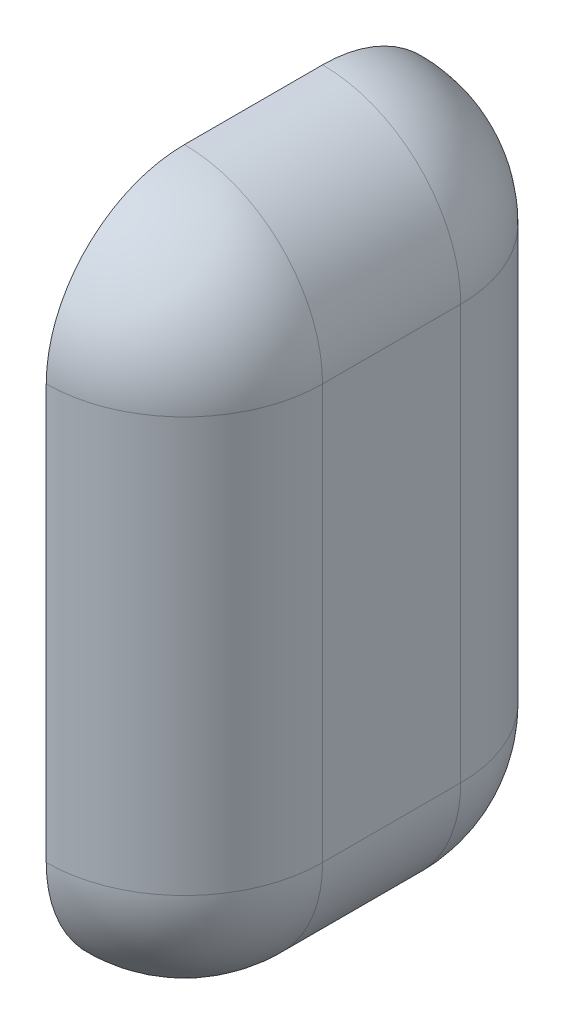
from build123d import *

# Parameters (mm, degrees)
BOSS_EXTRUDE1_DEPTH = 0.635
SKETCH2_W           = 3.81
SKETCH2_H           = 6.35
BOSS_EXTRUDE2_DEPTH = 1.27
FILLET4_R           = 1.27
FILLET5_R           = 1.27


with BuildPart() as part:
    # Sketch1 → Boss-Extrude1 (new body)
    with BuildSketch(Plane(origin=(0, 0, 0), x_dir=(0, 0, -1), z_dir=(1, 0, 0))):
        Polygon((-0.4445, 0.9525), (0.4445, 0.9525), (0.4445, -0.9525), (0.254, -1.2065), (-0.254, -1.2065), (-0.4445, -0.9525), align=None)
    extrude(amount=BOSS_EXTRUDE1_DEPTH)

    # Sketch2 → Boss-Extrude2 (add)
    with BuildSketch(Plane(origin=(0.635, 0, 0), x_dir=(0, 0, -1), z_dir=(1, 0, 0))):
        Rectangle(SKETCH2_W, SKETCH2_H)
    extrude(amount=BOSS_EXTRUDE2_DEPTH)

    # Fillet4
    fillet4_edges = [part.edges().sort_by_distance(p)[0] for p in [
        (1.905, -3.175, 0),
        (1.905, 3.175, 0),
    ]]
    fillet(fillet4_edges, radius=FILLET4_R - 0.0001)  # a hair under: the kernel refuses the full size

    # Fillet5
    fillet5_edges = [part.edges().sort_by_distance(p)[0] for p in [
        (1.905, 0, -1.905),
        (1.905, 0, 1.905),
        (1.533054901, 2.803054901, -1.905),
        (1.533054901, -2.803054901, -1.905),
        (1.533054901, 2.803054901, 1.905),
        (1.533054901, -2.803054901, 1.905),
    ]]
    fillet(fillet5_edges, radius=FILLET5_R - 0.0001)  # a hair under: the kernel refuses the full size


solid = part.part
